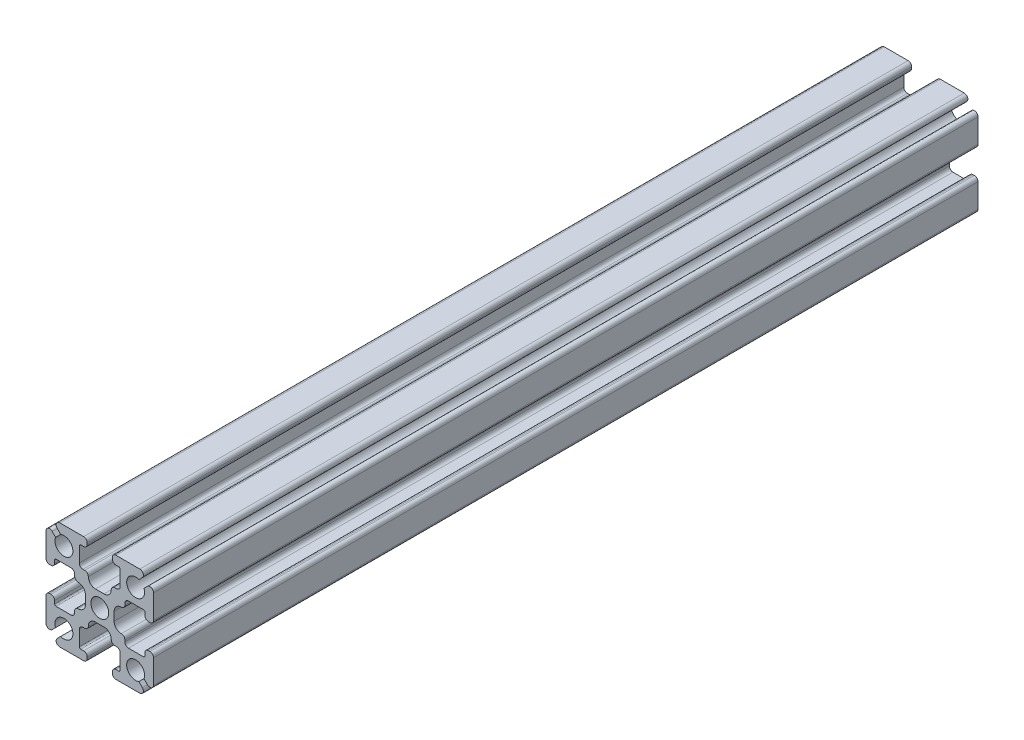
from build123d import *

# Parameters (mm, degrees)
SKETCH1_R           = 1.25
BOSS_EXTRUDE1_DEPTH = 115


with BuildPart() as part:
    # Sketch1 → Boss-Extrude1 (new body)
    with BuildSketch(Plane.XY):
        with BuildLine():
            Line((6.646446609, 5.939339828), (6.163645978, 5.456539197))
            ThreePointArc((6.163645978, 5.456539197), (4.116116524, 4.116116524), (5.456539197, 6.163645978))
            Line((5.456539197, 6.163645978), (5.939339828, 6.646446609))
            ThreePointArc((5.939339828, 6.646446609), (6.047726204, 7.191341716), (5.585786438, 7.5))
            Line((5.585786438, 7.5), (2.25, 7.5))
            ThreePointArc((2.25, 7.5), (1.896446609, 7.353553391), (1.75, 7))
            Line((1.75, 7), (1.75, 6.8))
            ThreePointArc((1.75, 6.8), (1.896446609, 6.446446609), (2.25, 6.3))
            Line((2.25, 6.3), (2.65, 6.3))
            ThreePointArc((2.65, 6.3), (2.791421356, 6.241421356), (2.85, 6.1))
            Line((2.85, 6.1), (2.85, 4))
            ThreePointArc((2.85, 4), (2.703553391, 3.646446609), (2.35, 3.5))
            Line((2.35, 3.5), (2.1, 3.5))
            ThreePointArc((2.1, 3.5), (1.746446609, 3.353553391), (1.6, 3))
            ThreePointArc((1.6, 3), (1.307106781, 2.292893219), (0.6, 2))
            Line((0.6, 2), (-0.6, 2))
            ThreePointArc((-0.6, 2), (-1.307106781, 2.292893219), (-1.6, 3))
            ThreePointArc((-1.6, 3), (-1.746446609, 3.353553391), (-2.1, 3.5))
            Line((-2.1, 3.5), (-2.35, 3.5))
            ThreePointArc((-2.35, 3.5), (-2.703553391, 3.646446609), (-2.85, 4))
            Line((-2.85, 4), (-2.85, 6.1))
            ThreePointArc((-2.85, 6.1), (-2.791421356, 6.241421356), (-2.65, 6.3))
            Line((-2.65, 6.3), (-2.25, 6.3))
            ThreePointArc((-2.25, 6.3), (-1.896446609, 6.446446609), (-1.75, 6.8))
            Line((-1.75, 6.8), (-1.75, 7))
            ThreePointArc((-1.75, 7), (-1.896446609, 7.353553391), (-2.25, 7.5))
            Line((-2.25, 7.5), (-5.585786438, 7.5))
            ThreePointArc((-5.585786438, 7.5), (-6.047726204, 7.191341716), (-5.939339828, 6.646446609))
            Line((-5.939339828, 6.646446609), (-5.456539197, 6.163645978))
            ThreePointArc((-5.456539197, 6.163645978), (-4.116116524, 4.116116524), (-6.163645978, 5.456539197))
            Line((-6.163645978, 5.456539197), (-6.646446609, 5.939339828))
            ThreePointArc((-6.646446609, 5.939339828), (-7.191341716, 6.047726204), (-7.5, 5.585786438))
            Line((-7.5, 5.585786438), (-7.5, 2.25))
            ThreePointArc((-7.5, 2.25), (-7.353553391, 1.896446609), (-7, 1.75))
            Line((-7, 1.75), (-6.8, 1.75))
            ThreePointArc((-6.8, 1.75), (-6.446446609, 1.896446609), (-6.3, 2.25))
            Line((-6.3, 2.25), (-6.3, 2.65))
            ThreePointArc((-6.3, 2.65), (-6.241421356, 2.791421356), (-6.1, 2.85))
            Line((-6.1, 2.85), (-4, 2.85))
            ThreePointArc((-4, 2.85), (-3.646446609, 2.703553391), (-3.5, 2.35))
            Line((-3.5, 2.35), (-3.5, 2.1))
            ThreePointArc((-3.5, 2.1), (-3.353553391, 1.746446609), (-3, 1.6))
            ThreePointArc((-3, 1.6), (-2.292893219, 1.307106781), (-2, 0.6))
            Line((-2, 0.6), (-2, -0.6))
            ThreePointArc((-2, -0.6), (-2.292893219, -1.307106781), (-3, -1.6))
            ThreePointArc((-3, -1.6), (-3.353553391, -1.746446609), (-3.5, -2.1))
            Line((-3.5, -2.1), (-3.5, -2.35))
            ThreePointArc((-3.5, -2.35), (-3.646446609, -2.703553391), (-4, -2.85))
            Line((-4, -2.85), (-6.1, -2.85))
            ThreePointArc((-6.1, -2.85), (-6.241421356, -2.791421356), (-6.3, -2.65))
            Line((-6.3, -2.65), (-6.3, -2.25))
            ThreePointArc((-6.3, -2.25), (-6.446446609, -1.896446609), (-6.8, -1.75))
            Line((-6.8, -1.75), (-7, -1.75))
            ThreePointArc((-7, -1.75), (-7.353553391, -1.896446609), (-7.5, -2.25))
            Line((-7.5, -2.25), (-7.5, -5.585786438))
            ThreePointArc((-7.5, -5.585786438), (-7.191341716, -6.047726204), (-6.646446609, -5.939339828))
            Line((-6.646446609, -5.939339828), (-6.163645978, -5.456539197))
            ThreePointArc((-6.163645978, -5.456539197), (-4.116116524, -4.116116524), (-5.456539197, -6.163645978))
            Line((-5.456539197, -6.163645978), (-5.939339828, -6.646446609))
            ThreePointArc((-5.939339828, -6.646446609), (-6.047726204, -7.191341716), (-5.585786438, -7.5))
            Line((-5.585786438, -7.5), (-2.25, -7.5))
            ThreePointArc((-2.25, -7.5), (-1.896446609, -7.353553391), (-1.75, -7))
            Line((-1.75, -7), (-1.75, -6.8))
            ThreePointArc((-1.75, -6.8), (-1.896446609, -6.446446609), (-2.25, -6.3))
            Line((-2.25, -6.3), (-2.65, -6.3))
            ThreePointArc((-2.65, -6.3), (-2.791421356, -6.241421356), (-2.85, -6.1))
            Line((-2.85, -6.1), (-2.85, -4))
            ThreePointArc((-2.85, -4), (-2.703553391, -3.646446609), (-2.35, -3.5))
            Line((-2.35, -3.5), (-2.1, -3.5))
            ThreePointArc((-2.1, -3.5), (-1.746446609, -3.353553391), (-1.6, -3))
            ThreePointArc((-1.6, -3), (-1.307106781, -2.292893219), (-0.6, -2))
            Line((-0.6, -2), (0.6, -2))
            ThreePointArc((0.6, -2), (1.307106781, -2.292893219), (1.6, -3))
            ThreePointArc((1.6, -3), (1.746446609, -3.353553391), (2.1, -3.5))
            Line((2.1, -3.5), (2.35, -3.5))
            ThreePointArc((2.35, -3.5), (2.703553391, -3.646446609), (2.85, -4))
            Line((2.85, -4), (2.85, -6.1))
            ThreePointArc((2.85, -6.1), (2.791421356, -6.241421356), (2.65, -6.3))
            Line((2.65, -6.3), (2.25, -6.3))
            ThreePointArc((2.25, -6.3), (1.896446609, -6.446446609), (1.75, -6.8))
            Line((1.75, -6.8), (1.75, -7))
            ThreePointArc((1.75, -7), (1.896446609, -7.353553391), (2.25, -7.5))
            Line((2.25, -7.5), (5.585786438, -7.5))
            ThreePointArc((5.585786438, -7.5), (6.047726204, -7.191341716), (5.939339828, -6.646446609))
            Line((5.939339828, -6.646446609), (5.456539197, -6.163645978))
            ThreePointArc((5.456539197, -6.163645978), (4.116116524, -4.116116524), (6.163645978, -5.456539197))
            Line((6.163645978, -5.456539197), (6.646446609, -5.939339828))
            ThreePointArc((6.646446609, -5.939339828), (7.191341716, -6.047726204), (7.5, -5.585786438))
            Line((7.5, -5.585786438), (7.5, -2.25))
            ThreePointArc((7.5, -2.25), (7.353553391, -1.896446609), (7, -1.75))
            Line((7, -1.75), (6.8, -1.75))
            ThreePointArc((6.8, -1.75), (6.446446609, -1.896446609), (6.3, -2.25))
            Line((6.3, -2.25), (6.3, -2.65))
            ThreePointArc((6.3, -2.65), (6.241421356, -2.791421356), (6.1, -2.85))
            Line((6.1, -2.85), (4, -2.85))
            ThreePointArc((4, -2.85), (3.646446609, -2.703553391), (3.5, -2.35))
            Line((3.5, -2.35), (3.5, -2.1))
            ThreePointArc((3.5, -2.1), (3.353553391, -1.746446609), (3, -1.6))
            ThreePointArc((3, -1.6), (2.292893219, -1.307106781), (2, -0.6))
            Line((2, -0.6), (2, 0.6))
            ThreePointArc((2, 0.6), (2.292893219, 1.307106781), (3, 1.6))
            ThreePointArc((3, 1.6), (3.353553391, 1.746446609), (3.5, 2.1))
            Line((3.5, 2.1), (3.5, 2.35))
            ThreePointArc((3.5, 2.35), (3.646446609, 2.703553391), (4, 2.85))
            Line((4, 2.85), (6.1, 2.85))
            ThreePointArc((6.1, 2.85), (6.241421356, 2.791421356), (6.3, 2.65))
            Line((6.3, 2.65), (6.3, 2.25))
            ThreePointArc((6.3, 2.25), (6.446446609, 1.896446609), (6.8, 1.75))
            Line((6.8, 1.75), (7, 1.75))
            ThreePointArc((7, 1.75), (7.353553391, 1.896446609), (7.5, 2.25))
            Line((7.5, 2.25), (7.5, 5.585786438))
            ThreePointArc((7.5, 5.585786438), (7.191341716, 6.047726204), (6.646446609, 5.939339828))
        make_face()
        Circle(SKETCH1_R, mode=Mode.SUBTRACT)
    extrude(amount=BOSS_EXTRUDE1_DEPTH)


solid = part.part
